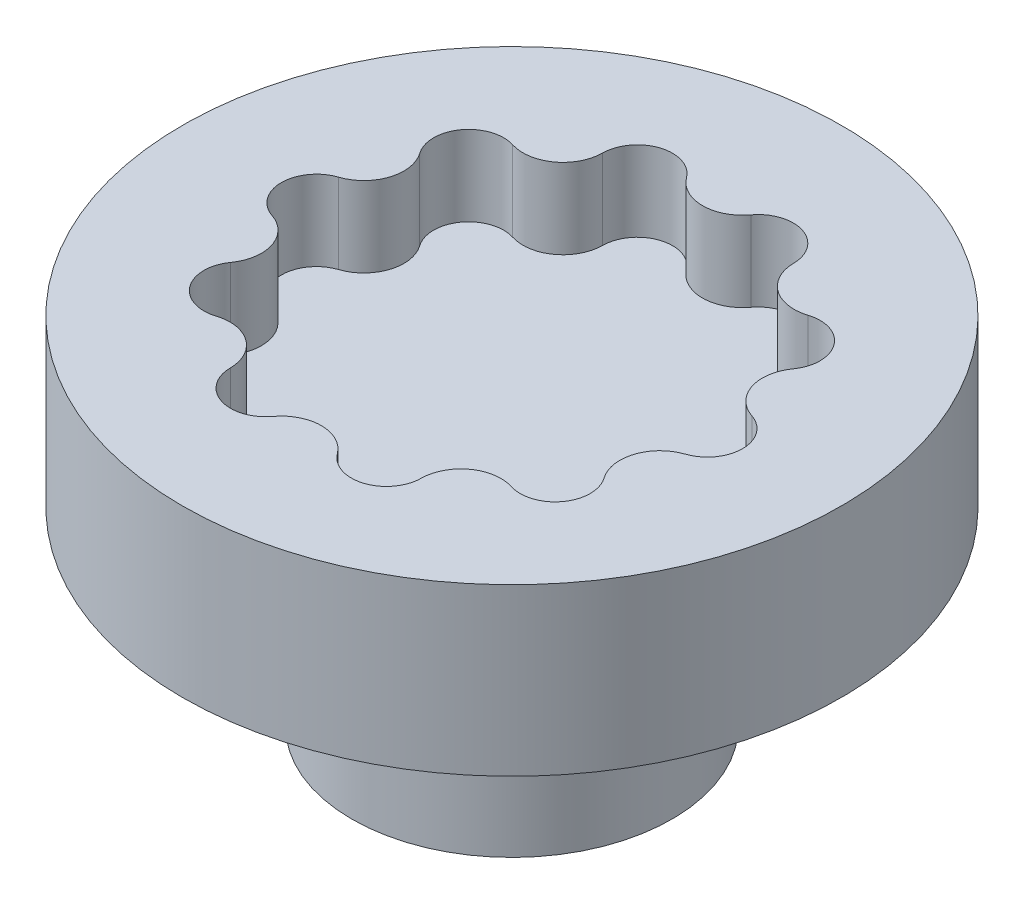
from build123d import *

# Parameters (mm, degrees)
SKETCH1_R                   = 26.14295
BOSS_EXTRUDE1_DEPTH         = 6.810375
SKETCH2_R                   = 12.7
BOSS_EXTRUDE2_DEPTH         = 15.08125
BOSS_EXTRUDE3_START         = 6.35
SKETCH3_R                   = 26.14295
BOSS_EXTRUDE3_DEPTH         = 6.35
F_1_4_20_TAPPED_HOLE1_D     = 5.1054
F_1_4_20_TAPPED_HOLE1_DEPTH = 16.51
F_1_4_20_TAPPED_HOLE1_TIP   = 1.533816902


with BuildPart() as part:
    # Sketch1 → Boss-Extrude1 (new body)
    with BuildSketch(Plane(origin=(0, 0, 0), x_dir=(1, 0, 0), z_dir=(0, 1, 0))):
        Circle(SKETCH1_R)
    extrude(amount=-BOSS_EXTRUDE1_DEPTH)

    # Sketch2 → Boss-Extrude2 (add)
    with BuildSketch(Plane.XZ.offset(6.810375)):
        Circle(SKETCH2_R)
    extrude(amount=BOSS_EXTRUDE2_DEPTH)

    # Sketch3 → Boss-Extrude3 (add)
    with BuildSketch(Plane(origin=(0, 0, 0), x_dir=(1, 0, 0), z_dir=(0, 1, 0)).offset(BOSS_EXTRUDE3_START)):
        Circle(SKETCH3_R)
        with BuildLine():
            ThreePointArc((2.553003524, 16.40046245), (5.651302793, 17.39292157), (7.574526721, 14.768870658))
            ThreePointArc((7.574526721, 14.768870658), (7.926495509, 13.34211974), (8.883198518, 12.226673836))
            ThreePointArc((8.883198518, 12.226673836), (10.239688102, 11.661486946), (11.705373197, 11.767635017))
            ThreePointArc((11.705373197, 11.767635017), (14.795302793, 10.749416694), (14.808845207, 7.496072251))
            ThreePointArc((14.808845207, 7.496072251), (14.25497079, 6.134924448), (14.373317131, 4.670173836))
            ThreePointArc((14.373317131, 4.670173836), (15.138531738, 3.415603465), (16.386688159, 2.639970974))
            ThreePointArc((16.386688159, 2.639970974), (18.288, 0), (16.386688159, -2.639970974))
            ThreePointArc((16.386688159, -2.639970974), (15.138531738, -3.415603465), (14.373317131, -4.670173836))
            ThreePointArc((14.373317131, -4.670173836), (14.25497079, -6.134924448), (14.808845207, -7.496072251))
            ThreePointArc((14.808845207, -7.496072251), (14.795302793, -10.749416694), (11.705373197, -11.767635017))
            ThreePointArc((11.705373197, -11.767635017), (10.239688102, -11.661486946), (8.883198518, -12.226673836))
            ThreePointArc((8.883198518, -12.226673836), (7.926495509, -13.34211974), (7.574526721, -14.768870658))
            ThreePointArc((7.574526721, -14.768870658), (5.651302793, -17.39292157), (2.553003524, -16.40046245))
            ThreePointArc((2.553003524, -16.40046245), (1.429631644, -15.453078773), (0, -15.113))
            ThreePointArc((0, -15.113), (-1.429631644, -15.453078773), (-2.553003524, -16.40046245))
            ThreePointArc((-2.553003524, -16.40046245), (-5.651302793, -17.39292157), (-7.574526721, -14.768870658))
            ThreePointArc((-7.574526721, -14.768870658), (-7.926495509, -13.34211974), (-8.883198518, -12.226673836))
            ThreePointArc((-8.883198518, -12.226673836), (-10.239688102, -11.661486946), (-11.705373197, -11.767635017))
            ThreePointArc((-11.705373197, -11.767635017), (-14.795302793, -10.749416694), (-14.808845207, -7.496072251))
            ThreePointArc((-14.808845207, -7.496072251), (-14.25497079, -6.134924448), (-14.373317131, -4.670173836))
            ThreePointArc((-14.373317131, -4.670173836), (-15.138531738, -3.415603465), (-16.386688159, -2.639970974))
            ThreePointArc((-16.386688159, -2.639970974), (-18.288, 0), (-16.386688159, 2.639970974))
            ThreePointArc((-16.386688159, 2.639970974), (-15.138531738, 3.415603465), (-14.373317131, 4.670173836))
            ThreePointArc((-14.373317131, 4.670173836), (-14.25497079, 6.134924448), (-14.808845207, 7.496072251))
            ThreePointArc((-14.808845207, 7.496072251), (-14.795302793, 10.749416694), (-11.705373197, 11.767635017))
            ThreePointArc((-11.705373197, 11.767635017), (-10.239688102, 11.661486946), (-8.883198518, 12.226673836))
            ThreePointArc((-8.883198518, 12.226673836), (-7.926495509, 13.34211974), (-7.574526721, 14.768870658))
            ThreePointArc((-7.574526721, 14.768870658), (-5.651302793, 17.39292157), (-2.553003524, 16.40046245))
            ThreePointArc((-2.553003524, 16.40046245), (-1.429631644, 15.453078773), (0, 15.113))
            ThreePointArc((0, 15.113), (1.429631644, 15.453078773), (2.553003524, 16.40046245))
        make_face(mode=Mode.SUBTRACT)
    extrude(amount=-BOSS_EXTRUDE3_DEPTH)

    # 1/4-20 Tapped Hole1
    with Locations(Plane(origin=(0, -21.891625, 0), x_dir=(-1, 0, 0), z_dir=(0, -1, 0))):
        with Locations((0, 6.35), (5.499261314, -3.175), (-5.499261314, -3.175)):
            Hole(F_1_4_20_TAPPED_HOLE1_D / 2, depth=F_1_4_20_TAPPED_HOLE1_DEPTH)
            with Locations((0, 0, -(F_1_4_20_TAPPED_HOLE1_DEPTH + F_1_4_20_TAPPED_HOLE1_TIP / 2))):  # 118° drill point
                Cone(0, F_1_4_20_TAPPED_HOLE1_D / 2, F_1_4_20_TAPPED_HOLE1_TIP, mode=Mode.SUBTRACT)


solid = part.part
